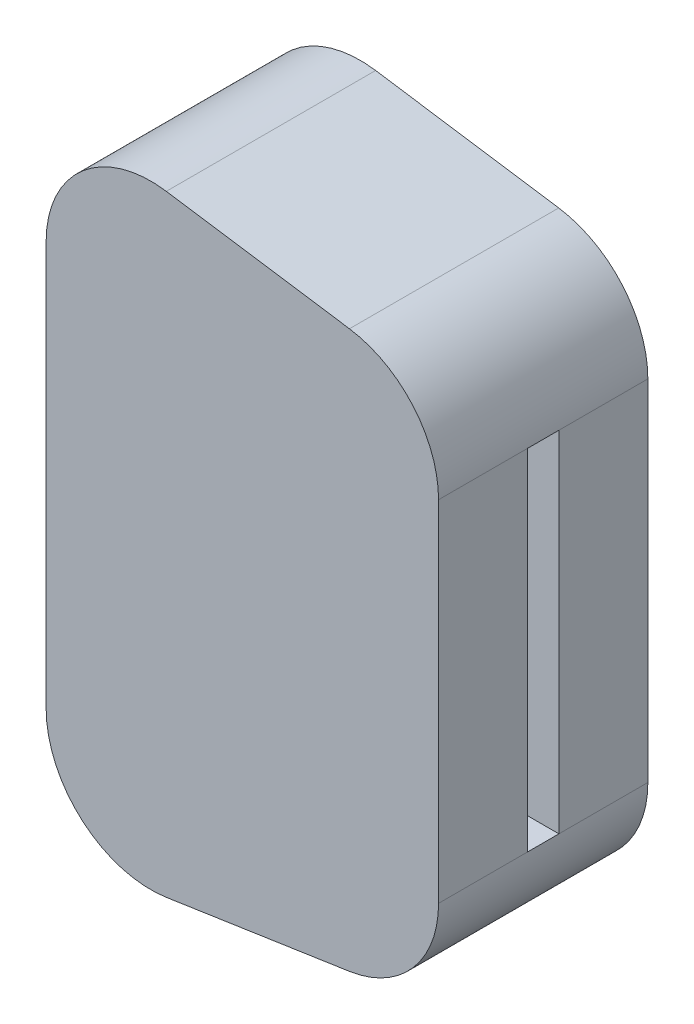
from build123d import *

# Parameters (mm, degrees)
BOSS_EXTRUDE1_DEPTH = 20
SKETCH5_W           = 9
SKETCH5_H           = 1.454272164
CUT_EXTRUDE4_DEPTH  = 10
SKETCH6_R           = 0.5
CUT_EXTRUDE5_DEPTH  = 5
SKETCH7_W           = 3
SKETCH7_H           = 33.401251584
CUT_EXTRUDE7_DEPTH  = 23


with BuildPart() as part:
    # Sketch1 → Boss-Extrude1 (new body)
    with BuildSketch(Plane.XY):
        with BuildLine():
            Line((0, 19.325625792), (0, -19.325625792))
            ThreePointArc((0, -19.325625792), (3.474436626, -26.903027896), (11.483404529, -29.214989321))
            Line((11.483404529, -29.214989321), (28.983404529, -26.589989321))
            ThreePointArc((28.983404529, -26.589989321), (35.077402104, -23.226189166), (37.5, -16.700625792))
            Line((37.5, -16.700625792), (37.5, 16.700625792))
            ThreePointArc((37.5, 16.700625792), (35.077402104, 23.226189166), (28.983404529, 26.589989321))
            Line((28.983404529, 26.589989321), (11.483404529, 29.214989321))
            ThreePointArc((11.483404529, 29.214989321), (3.474436626, 26.903027896), (0, 19.325625792))
        make_face()
    extrude(amount=BOSS_EXTRUDE1_DEPTH)

    # Sketch5 → Cut-Extrude4 (cut)
    with BuildSketch(Plane.ZY):
        with Locations((10, 16.569972364)):
            Rectangle(SKETCH5_W, SKETCH5_H)
    extrude(amount=-CUT_EXTRUDE4_DEPTH, mode=Mode.SUBTRACT)

    # Sketch6 → Cut-Extrude5 (cut)
    with BuildSketch(Plane.XZ.offset(-17.297108446)):
        with Locations((2.644871575, 10)):
            Circle(SKETCH6_R)
    extrude(amount=-CUT_EXTRUDE5_DEPTH, mode=Mode.SUBTRACT)

    # Sketch7 → Cut-Extrude7 (cut)
    with BuildSketch(Plane(origin=(37.5, 0, 0), x_dir=(0, 0, -1), z_dir=(1, 0, 0))):
        with Locations((-10, 0)):
            Rectangle(SKETCH7_W, SKETCH7_H)
    extrude(amount=-CUT_EXTRUDE7_DEPTH, mode=Mode.SUBTRACT)


solid = part.part
